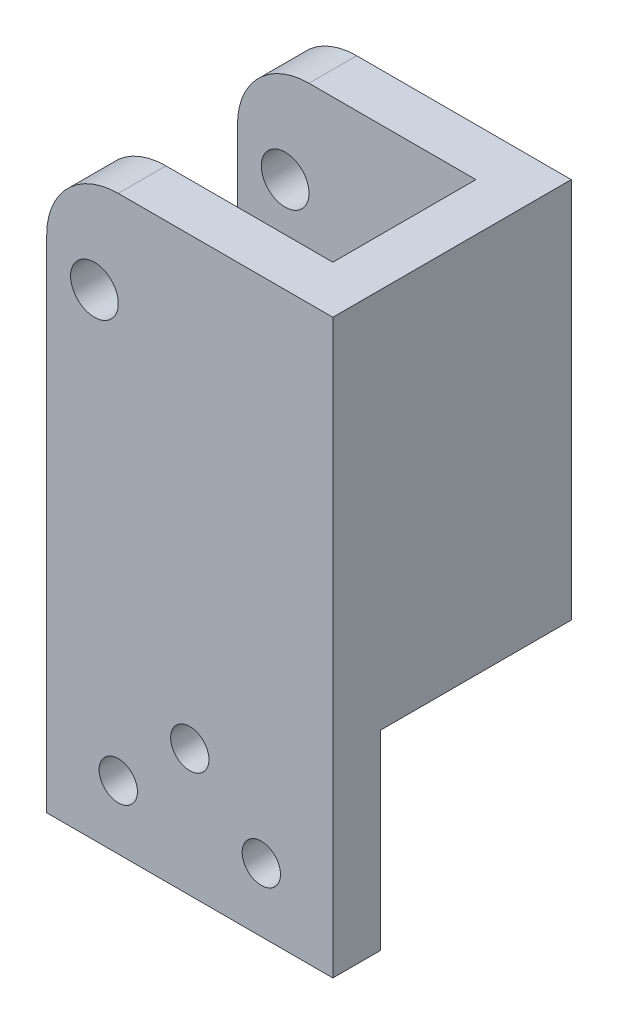
from build123d import *

# Parameters (mm, degrees)
SKETCH1_W                   = 38.1
SKETCH1_H                   = 76.2
BOSS_EXTRUDE1_DEPTH         = 31.75
SKETCH3_W                   = 25.4
SKETCH3_H                   = 76.2
CUT_EXTRUDE2_DEPTH          = 31.75
SKETCH4_W                   = 25.4
SKETCH4_H                   = 25.4
CUT_EXTRUDE3_DEPTH          = 89.44526556
SKETCH5_W                   = 31.75
SKETCH5_H                   = 6.35
BOSS_EXTRUDE2_DEPTH         = 50.8
SKETCH6_R                   = 3.175
CUT_EXTRUDE4_DEPTH          = 50.8
FILLET2_R                   = 9.525
SKETCH7_W                   = 31.75
SKETCH7_H                   = 19.05
BOSS_EXTRUDE3_DEPTH         = 6.35
F_1_4_20_TAPPED_HOLE2_D     = 5.1054
F_1_4_20_TAPPED_HOLE2_DEPTH = 16.51
F_1_4_20_TAPPED_HOLE2_TIP   = 1.533816902


with BuildPart() as part:
    # Sketch1 → Boss-Extrude1 (new body)
    with BuildSketch(Plane.XY):
        with Locations((19.05, 38.1)):
            Rectangle(SKETCH1_W, SKETCH1_H)
    extrude(amount=-BOSS_EXTRUDE1_DEPTH)

    # Sketch3 → Cut-Extrude2 (cut)
    with BuildSketch(Plane.ZY):
        with Locations((-19.05, 38.1)):
            Rectangle(SKETCH3_W, SKETCH3_H)
    extrude(amount=-CUT_EXTRUDE2_DEPTH, mode=Mode.SUBTRACT)

    # Sketch4 → Cut-Extrude3 (cut, through all)
    with BuildSketch(Plane.ZY.offset(-31.75)):
        with Locations((-19.05, 12.7)):
            Rectangle(SKETCH4_W, SKETCH4_H)
    extrude(amount=-CUT_EXTRUDE3_DEPTH, mode=Mode.SUBTRACT)

    # Sketch5 → Boss-Extrude2 (add)
    with BuildSketch(Plane(origin=(0, 76.2, 0), x_dir=(1, 0, 0), z_dir=(0, 1, 0))):
        with Locations((15.875, 28.575)):
            Rectangle(SKETCH5_W, SKETCH5_H)
    extrude(amount=-BOSS_EXTRUDE2_DEPTH)

    # Sketch6 → Cut-Extrude4 (cut)
    with BuildSketch(Plane(origin=(0, 0, -31.75), x_dir=(-1, 0, 0), z_dir=(0, 0, -1))):
        with Locations((-6.35, 63.5)):
            Circle(SKETCH6_R)
    extrude(amount=-CUT_EXTRUDE4_DEPTH, mode=Mode.SUBTRACT)

    # Fillet2
    fillet2_edges = [part.edges().sort_by_distance(p)[0] for p in [
        (0, 76.2, -3.175),
        (0, 76.2, -28.575),
    ]]
    fillet(fillet2_edges, radius=FILLET2_R)

    # Sketch7 → Boss-Extrude3 (add)
    with BuildSketch(Plane(origin=(0, 25.4, 0), x_dir=(-1, 0, 0), z_dir=(0, -1, 0))):
        with Locations((-15.875, 15.875)):
            Rectangle(SKETCH7_W, SKETCH7_H)
    extrude(amount=-BOSS_EXTRUDE3_DEPTH)

    # 1/4-20 Tapped Hole2
    with Locations(Plane(origin=(9.525, 8.466666667, 0), x_dir=(1, 0, 0), z_dir=(0, 0, 1))):
        with Locations((0, 0), (9.525, 8.466666666), (19.05, 0)):
            Hole(F_1_4_20_TAPPED_HOLE2_D / 2, depth=F_1_4_20_TAPPED_HOLE2_DEPTH)
            with Locations((0, 0, -(F_1_4_20_TAPPED_HOLE2_DEPTH + F_1_4_20_TAPPED_HOLE2_TIP / 2))):  # 118° drill point
                Cone(0, F_1_4_20_TAPPED_HOLE2_D / 2, F_1_4_20_TAPPED_HOLE2_TIP, mode=Mode.SUBTRACT)


solid = part.part
